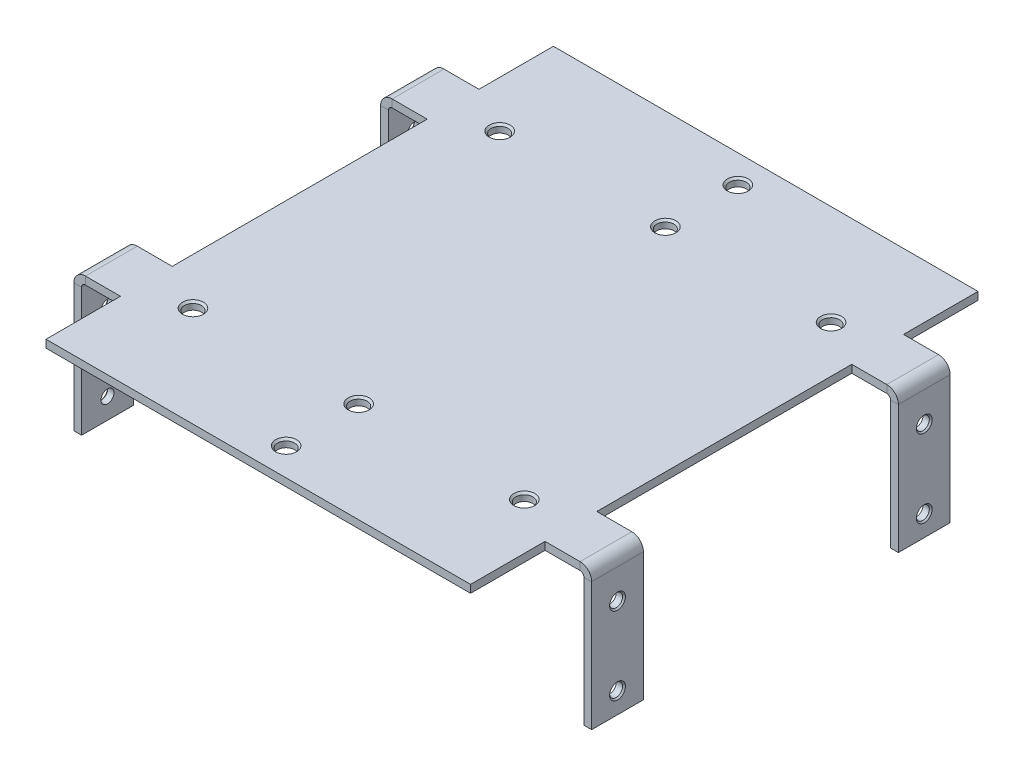
from build123d import *

# Parameters (mm, degrees)
BASE_FLANGE1_DEPTH           = 1.5
EDGE_FLANGE1_STRIP_W         = 7.4732
EDGE_FLANGE1_STRIP_H         = 1.5
EDGE_FLANGE1_STRIP_CUT_DEPTH = 10
EDGE_FLANGE1_DEPTH           = 10
M3_TAPPED_HOLE1_D            = 2.5
M3_TAPPED_HOLE1_CSINK_D      = 3.05
M3_TAPPED_HOLE1_CSINK_ANGLE  = 90
MIRROR2_COPY_1_SKETCH_W      = 7.4732
MIRROR2_COPY_1_SKETCH_H      = 1.5
MIRROR2_COPY_1_DEPTH         = 10
MIRROR2_COPY_2_DEPTH         = 10
MIRROR2_COPY_3_D             = 2.5
MIRROR2_COPY_3_CSINK_D       = 3.05
MIRROR2_COPY_3_CSINK_ANGLE   = 90
M4_TAPPED_HOLE1_D            = 3.3
M4_TAPPED_HOLE1_CSINK_D      = 4.05
M4_TAPPED_HOLE1_CSINK_ANGLE  = 90


# Sheet-metal steps are written as plain solids
with BuildPart() as part:
    # Sketch1 → Base-Flange1 (new body)
    with BuildSketch(Plane(origin=(0, 0, 0), x_dir=(1, 0, 0), z_dir=(0, 1, 0))):
        Polygon((-41, -34.62), (-41, -49), (41, -49), (41, -34.62), (50, -34.62), (50, -24.62), (41, -24.62), (41, 24.62), (50, 24.62), (50, 34.62), (41, 34.62), (41, 49), (-41, 49), (-41, 34.62), (-50, 34.62), (-50, 24.62), (-41, 24.62), (-41, -24.62), (-50, -24.62), (-50, -34.62), align=None)
    extrude(amount=-BASE_FLANGE1_DEPTH)

    # Edge-Flange1 strip (across the edge) → Edge-Flange1 strip cut (cut)
    with BuildSketch(Plane(origin=(-50, -1.5, 34.62), x_dir=(1, 0, 0), z_dir=(0, 0, -1))):
        with Locations((-1.5, -0.75)):
            Rectangle(EDGE_FLANGE1_STRIP_W, EDGE_FLANGE1_STRIP_H)
    edge_flange1_strip_cut = extrude(amount=EDGE_FLANGE1_STRIP_CUT_DEPTH, mode=Mode.SUBTRACT)

    # Edge-Flange1 section (across the edge) → Edge-Flange1 (add)
    with BuildSketch(Plane(origin=(-50, -1.5, 34.62), x_dir=(1, 0, 0), z_dir=(0, 0, -1))):
        with BuildLine():
            Line((0, 0.7366), (0, 25.5))
            Line((0, 25.5), (1.5, 25.5))
            Line((1.5, 25.5), (1.5, 0.7366))
            ThreePointArc((1.5, 0.7366), (1.715745145, 0.215745145), (2.2366, 0))
            Line((2.2366, 0), (2.2366, -1.5))
            ThreePointArc((2.2366, -1.5), (0.655084973, -0.844915027), (0, 0.7366))
        make_face()
    edge_flange1 = extrude(amount=EDGE_FLANGE1_DEPTH)

    # M3 Tapped Hole1 (through all)
    with Locations(Plane.ZY.offset(50)):
        with Locations((29.62, -8), (29.62, -23)):
            m3_tapped_hole1 = CounterSinkHole(M3_TAPPED_HOLE1_D / 2, M3_TAPPED_HOLE1_CSINK_D / 2, counter_sink_angle=M3_TAPPED_HOLE1_CSINK_ANGLE)

    # Mirror1: Edge-Flange1 strip cut, Edge-Flange1, M3 Tapped Hole1 across plane
    add(edge_flange1_strip_cut.mirror(Plane(origin=(0, 0, 0), x_dir=(0, 0, 1), z_dir=(1, 0, 0))), mode=Mode.SUBTRACT)
    add(edge_flange1.mirror(Plane(origin=(0, 0, 0), x_dir=(0, 0, 1), z_dir=(1, 0, 0))))
    add(m3_tapped_hole1.mirror(Plane(origin=(0, 0, 0), x_dir=(0, 0, 1), z_dir=(1, 0, 0))), mode=Mode.SUBTRACT)

    # Mirror2: Edge-Flange1 strip cut, Edge-Flange1, M3 Tapped Hole1 across plane
    add(edge_flange1_strip_cut.mirror(Plane.XY), mode=Mode.SUBTRACT)
    add(edge_flange1.mirror(Plane.XY))
    add(m3_tapped_hole1.mirror(Plane.XY), mode=Mode.SUBTRACT)

    # Mirror2 copy 1 sketch → Mirror2 copy 1 (cut)
    with BuildSketch(Plane(origin=(50, -1.5, -34.62), x_dir=(-1, 0, 0), z_dir=(0, 0, 1))):
        with Locations((-1.5, -0.75)):
            Rectangle(MIRROR2_COPY_1_SKETCH_W, MIRROR2_COPY_1_SKETCH_H)
    extrude(amount=MIRROR2_COPY_1_DEPTH, mode=Mode.SUBTRACT)

    # Mirror2 copy 2 sketch → Mirror2 copy 2 (add)
    with BuildSketch(Plane(origin=(50, -1.5, -34.62), x_dir=(-1, 0, 0), z_dir=(0, 0, 1))):
        with BuildLine():
            Line((0, 0.7366), (0, 25.5))
            Line((0, 25.5), (1.5, 25.5))
            Line((1.5, 25.5), (1.5, 0.7366))
            ThreePointArc((1.5, 0.7366), (1.715745145, 0.215745145), (2.2366, 0))
            Line((2.2366, 0), (2.2366, -1.5))
            ThreePointArc((2.2366, -1.5), (0.655084973, -0.844915027), (0, 0.7366))
        make_face()
    extrude(amount=MIRROR2_COPY_2_DEPTH)

    # Mirror2 copy 3 (through all)
    with Locations(Plane(origin=(50, 0, 0), x_dir=(0, 0, -1), z_dir=(1, 0, 0))):
        with Locations((29.62, -8), (29.62, -23)):
            CounterSinkHole(MIRROR2_COPY_3_D / 2, MIRROR2_COPY_3_CSINK_D / 2, counter_sink_angle=MIRROR2_COPY_3_CSINK_ANGLE)

    # M4 Tapped Hole1 (through all)
    with Locations(Plane(origin=(0, 0, 0), x_dir=(1, 0, 0), z_dir=(0, 1, 0))):
        with Locations((-32, 29.62), (0, 29.62), (32, 29.62), (-32, -29.62), (0, -29.62), (32, -29.62), (0, 43.62), (0, -43.62)):
            CounterSinkHole(M4_TAPPED_HOLE1_D / 2, M4_TAPPED_HOLE1_CSINK_D / 2, counter_sink_angle=M4_TAPPED_HOLE1_CSINK_ANGLE)


solid = part.part
